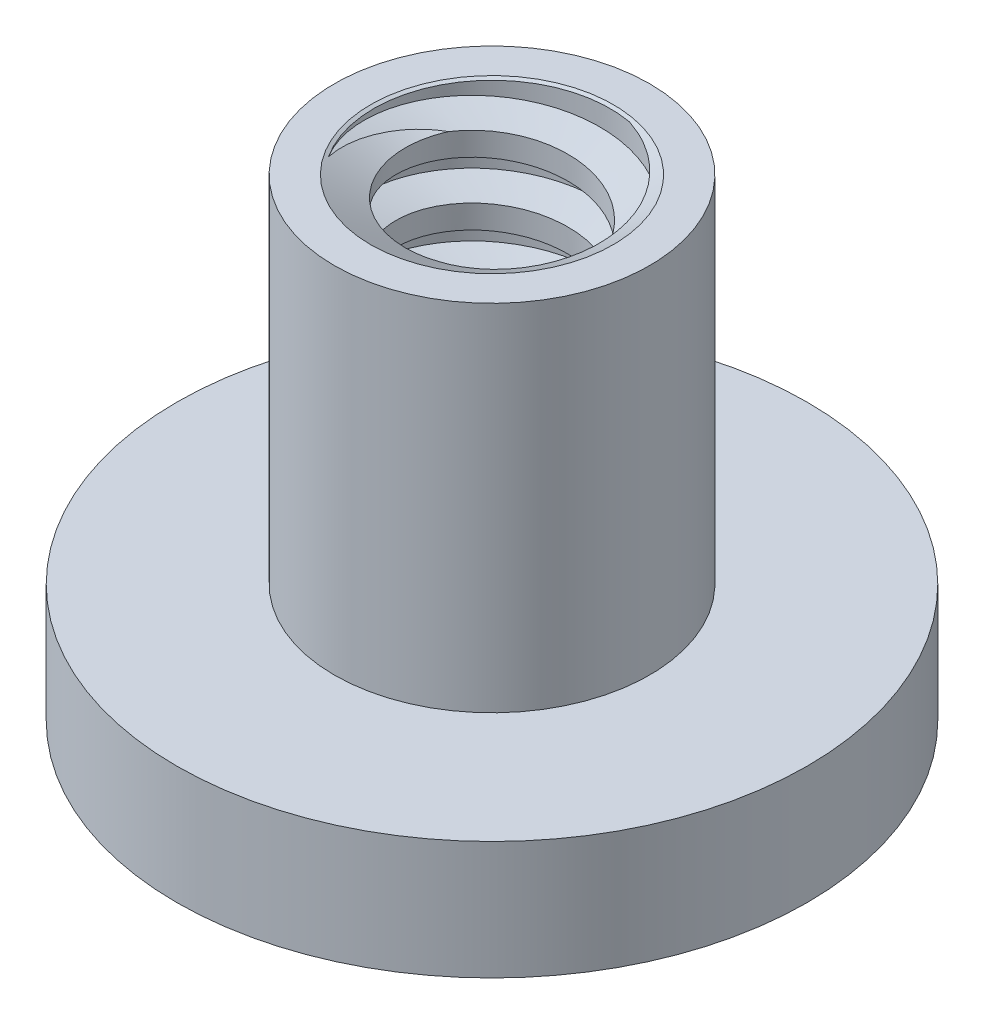
from build123d import *

# Parameters (mm, degrees)
SKETCH1_R                    = 25.4
BOSS_EXTRUDE1_DEPTH          = 38.1
CUT_EXTRUDE1_REACH           = 54.363
SKETCH2_R                    = 9.525
SWEEP1_PITCH                 = 5.08
SKETCH5_R                    = 9.779
CUT_EXTRUDE3_OTHER_WAY_DEPTH = 57.167954556
CUT_EXTRUDE3_OTHER_WAY_TAPER = -60
SKETCH6_R                    = 9.779
CUT_EXTRUDE4_OTHER_WAY_DEPTH = 53.363441615
CUT_EXTRUDE4_OTHER_WAY_TAPER = -60
SKETCH7_OUTSIDE_W            = 69.064
SKETCH7_OUTSIDE_H            = 69.064
SKETCH7_OUTSIDE_R            = 12.7
CUT_EXTRUDE5_DEPTH           = 28.575


with BuildPart() as part:
    # Sketch1 → Boss-Extrude1 (new body)
    with BuildSketch(Plane(origin=(0, 0, 0), x_dir=(1, 0, 0), z_dir=(0, 1, 0))):
        with Locations(Location((0, 0, 0), (0, 0, 90))):
            Circle(SKETCH1_R)
    extrude(amount=BOSS_EXTRUDE1_DEPTH)

    # Sketch2 → Cut-Extrude1 (cut, up to next)
    with BuildSketch(Plane(origin=(0, 38.1, 0), x_dir=(1, 0, 0), z_dir=(0, 1, 0)), mode=Mode.PRIVATE) as cut_extrude1_sk1:
        with Locations(Location((0, 0, 0), (0, 0, 270))):
            Circle(SKETCH2_R)
    cut_extrude1_tool1 = extrude(cut_extrude1_sk1.sketch, amount=-CUT_EXTRUDE1_REACH, mode=Mode.PRIVATE) & part.part
    add(cut_extrude1_tool1.solids().sort_by_distance((0, 38.1, 0))[0], mode=Mode.SUBTRACT)

    # Sweep1: the profile of Sketch4 profile screwed along a right-hand helix of 8.5 turns, 12 arcs to a turn; built about Z, then put on its axis
    sweep1_z = Axis((0, 0, 0), (0, 0, 1))
    sweep1_corners = [(9.5253, 0, -3.19696625), (6.985, 0, -2.54), (6.985, 0, -0.656888664), (9.5253, 0, 7.7585e-05)]
    with BuildLine(mode=Mode.PRIVATE) as sweep1_profile:
        Line(sweep1_corners[0], sweep1_corners[1])
        Line(sweep1_corners[1], sweep1_corners[2])
        Line(sweep1_corners[2], sweep1_corners[3])
        Line(sweep1_corners[3], sweep1_corners[0])
    sweep1_cap = Face(sweep1_profile.wire())
    sweep1_turn_angles = [0, 15, 30, 45, 60, 75, 90, 105, 120, 135, 150, 165, 180, 195, 210, 225, 240, 255, 270, 285, 300, 315, 330, 345, 360]
    sweep1_turn_weights = [1, 0.9659258262890683, 1, 0.9659258262890683, 1, 0.9659258262890683, 1, 0.9659258262890683, 1, 0.9659258262890683, 1, 0.9659258262890683, 1, 0.9659258262890683, 1, 0.9659258262890683, 1, 0.9659258262890683, 1, 0.9659258262890683, 1, 0.9659258262890683, 1, 0.9659258262890683, 1]
    sweep1_turn_rails = [Edge.make_bspline([Vector(p[0], p[1], 0).rotate(sweep1_z, sweep1_turn_angles[k]) / sweep1_turn_weights[k] + Vector(0, 0, p[2] + SWEEP1_PITCH * sweep1_turn_angles[k] / 360) for k in range(25)], [0, 0, 0, 1, 1, 2, 2, 3, 3, 4, 4, 5, 5, 6, 6, 7, 7, 8, 8, 9, 9, 10, 10, 11, 11, 12, 12, 12], 2, sweep1_turn_weights) for p in sweep1_corners]
    sweep1_turn_sides = [Face.make_surface_from_curves(sweep1_turn_rails[p[0]], sweep1_turn_rails[p[1]]) for p in [(0, 1), (1, 2), (2, 3), (3, 0)]]
    sweep1_last_angles = [2880, 2895, 2910, 2925, 2940, 2955, 2970, 2985, 3000, 3015, 3030, 3045, 3060]
    sweep1_last_weights = [1, 0.9659258262890683, 1, 0.9659258262890683, 1, 0.9659258262890683, 1, 0.9659258262890683, 1, 0.9659258262890683, 1, 0.9659258262890724, 1]
    sweep1_last_rails = [Edge.make_bspline([Vector(p[0], p[1], 0).rotate(sweep1_z, sweep1_last_angles[k]) / sweep1_last_weights[k] + Vector(0, 0, p[2] + SWEEP1_PITCH * sweep1_last_angles[k] / 360) for k in range(13)], [0, 0, 0, 1, 1, 2, 2, 3, 3, 4, 4, 5, 5, 6, 6, 6], 2, sweep1_last_weights) for p in sweep1_corners]
    sweep1_last_sides = [Face.make_surface_from_curves(sweep1_last_rails[p[0]], sweep1_last_rails[p[1]]) for p in [(0, 1), (1, 2), (2, 3), (3, 0)]]
    sweep1 = Plane(origin=(0, 38.1, 0), x_dir=(0, 0, -1), z_dir=(0, -1, 0)) * Solid(Shell([*[p.moved(Location((0, 0, SWEEP1_PITCH * i))) for i in range(8) for p in sweep1_turn_sides], *sweep1_last_sides, sweep1_cap, sweep1_cap.rotate(sweep1_z, 3060).moved(Location((0, 0, SWEEP1_PITCH * 3060 / 360)))]))
    add(sweep1)

    # Cut-Extrude3 cone 1 section (through the dimple's axis) → Cut-Extrude3 (revolve, cut)
    with BuildSketch(Plane(origin=(0, 38.1, 0), x_dir=(0, 0, 1), z_dir=(1, 0, 0))):
        Polygon((0, 0), (9.779, 0), (0, 5.645908282), align=None)
    revolve(axis=Axis((0, 38.1, 0), (0, -1, 0)), mode=Mode.SUBTRACT)

    # Sketch5 → Cut-Extrude3 other way (cut)
    with BuildSketch(Plane(origin=(0, 38.1, 0), x_dir=(1, 0, 0), z_dir=(0, 1, 0))):
        Circle(SKETCH5_R)
    extrude(amount=CUT_EXTRUDE3_OTHER_WAY_DEPTH, taper=CUT_EXTRUDE3_OTHER_WAY_TAPER, mode=Mode.SUBTRACT)

    # Cut-Extrude4 cone 1 section (through the dimple's axis) → Cut-Extrude4 (revolve, cut)
    with BuildSketch(Plane(origin=(0, 0, 0), x_dir=(0, 0, -1), z_dir=(1, 0, 0))):
        Polygon((0, 0), (9.779, 0), (0, 5.645908282), align=None)
    revolve(axis=Axis((0, 0, 0), (0, 1, 0)), mode=Mode.SUBTRACT)

    # Sketch6 → Cut-Extrude4 other way (cut)
    with BuildSketch(Plane.XZ):
        Circle(SKETCH6_R)
    extrude(amount=CUT_EXTRUDE4_OTHER_WAY_DEPTH, taper=CUT_EXTRUDE4_OTHER_WAY_TAPER, mode=Mode.SUBTRACT)

    # Sketch7 outside → Cut-Extrude5 (cut)
    with BuildSketch(Plane(origin=(0, 38.1, 0), x_dir=(1, 0, 0), z_dir=(0, 1, 0))):
        Rectangle(SKETCH7_OUTSIDE_W, SKETCH7_OUTSIDE_H)
        with Locations(Location((0, 0, 0), (0, 0, 270))):
            Circle(SKETCH7_OUTSIDE_R, mode=Mode.SUBTRACT)
    extrude(amount=-CUT_EXTRUDE5_DEPTH, mode=Mode.SUBTRACT)


solid = part.part
